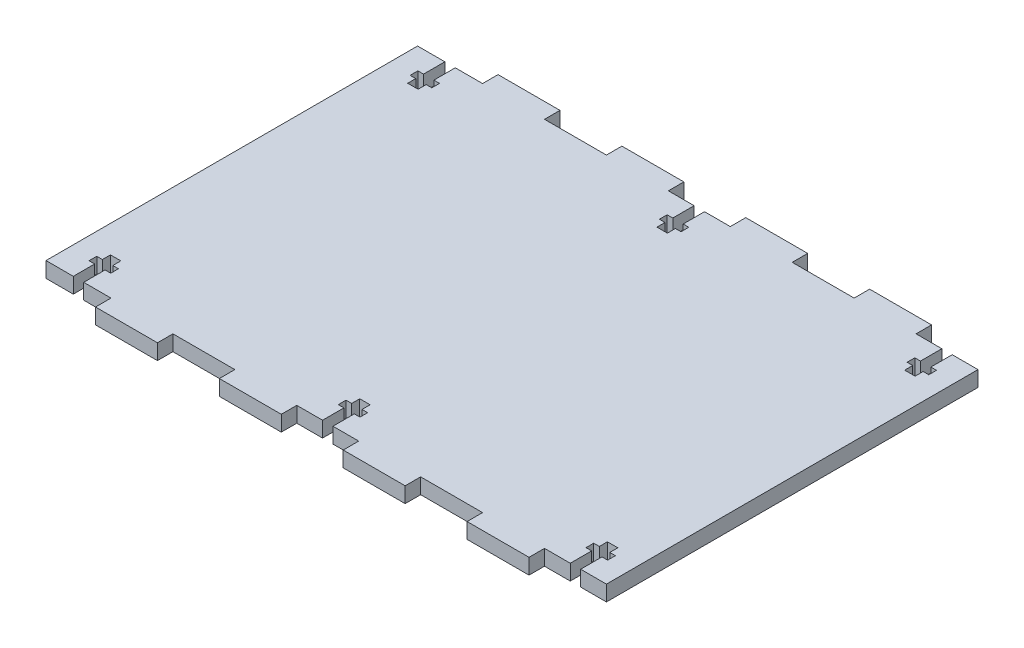
from build123d import *

# Parameters (mm, degrees)
SKETCH1_W           = 229.859874896
SKETCH1_H           = 6.35
BOSS_EXTRUDE1_DEPTH = 152.4
SKETCH2_W           = 25.4
SKETCH2_H           = 6.35
BOSS_EXTRUDE2_DEPTH = 6.35
LPATTERN1_COUNT     = 4
LPATTERN1_PITCH     = 50.8
SKETCH3_W           = 25.4
SKETCH3_H           = 6.35
BOSS_EXTRUDE3_DEPTH = 6.35
LPATTERN2_COUNT     = 4
LPATTERN2_PITCH     = 50.8
CUT_EXTRUDE1_DEPTH  = 6.35


with BuildPart() as part:
    # Sketch1 → Boss-Extrude1 (new body)
    with BuildSketch(Plane.XY):
        with Locations((-24.419947229, 152.4)):
            Rectangle(SKETCH1_W, SKETCH1_H)
    extrude(amount=BOSS_EXTRUDE1_DEPTH)

    # Sketch2 → Boss-Extrude2 (add)
    with BuildSketch(Plane(origin=(0, 155.575, 0), x_dir=(1, 0, 0), z_dir=(0, 1, 0))):
        with Locations((52.409990219, 3.175)):
            Rectangle(SKETCH2_W, SKETCH2_H)
    boss_extrude2 = extrude(amount=-BOSS_EXTRUDE2_DEPTH)

    # LPattern1: Boss-Extrude2 ×4
    with Locations(*[(-i * LPATTERN1_PITCH, 0, 0) for i in range(1, LPATTERN1_COUNT)]):
        add(boss_extrude2)

    # Sketch3 → Boss-Extrude3 (add)
    with BuildSketch(Plane.XY.offset(152.4)):
        with Locations((52.409990219, 152.4)):
            Rectangle(SKETCH3_W, SKETCH3_H)
    boss_extrude3 = extrude(amount=BOSS_EXTRUDE3_DEPTH)

    # LPattern2: Boss-Extrude3 ×4
    with Locations(*[(-i * LPATTERN2_PITCH, 0, 0) for i in range(1, LPATTERN2_COUNT)]):
        add(boss_extrude3)

    # Sketch4 → Cut-Extrude1 (cut)
    with BuildSketch(Plane(origin=(0, 155.575, 0), x_dir=(1, 0, 0), z_dir=(0, 1, 0))):
        Polygon((-123.886347229, 0), (-128.153547229, 0), (-128.153547229, -8.763), (-130.464947229, -8.763), (-130.464947229, -11.938), (-128.153547229, -11.938), (-128.153547229, -15.24), (-123.886347229, -15.24), (-123.886347229, -11.938), (-121.574947229, -11.938), (-121.574947229, -8.763), (-123.886347229, -8.763), align=None)
        Polygon((-21.656409781, 0), (-25.923609781, 0), (-25.923609781, -8.763), (-28.235009781, -8.763), (-28.235009781, -11.938), (-25.923609781, -11.938), (-25.923609781, -15.24), (-21.656409781, -15.24), (-21.656409781, -11.938), (-19.345009781, -11.938), (-19.345009781, -8.763), (-21.656409781, -8.763), align=None)
        Polygon((79.943590219, 0), (75.676390219, 0), (75.676390219, -8.763), (73.364990219, -8.763), (73.364990219, -11.938), (75.676390219, -11.938), (75.676390219, -15.24), (79.943590219, -15.24), (79.943590219, -11.938), (82.254990219, -11.938), (82.254990219, -8.763), (79.943590219, -8.763), align=None)
        Polygon((-128.153547229, -152.4), (-123.886347229, -152.4), (-123.886347229, -143.637), (-121.574947229, -143.637), (-121.574947229, -140.462), (-123.886347229, -140.462), (-123.886347229, -137.16), (-128.153547229, -137.16), (-128.153547229, -140.462), (-130.464947229, -140.462), (-130.464947229, -143.637), (-128.153547229, -143.637), align=None)
        Polygon((-25.923609781, -152.4), (-21.656409781, -152.4), (-21.656409781, -143.637), (-19.345009781, -143.637), (-19.345009781, -140.462), (-21.656409781, -140.462), (-21.656409781, -137.16), (-25.923609781, -137.16), (-25.923609781, -140.462), (-28.235009781, -140.462), (-28.235009781, -143.637), (-25.923609781, -143.637), align=None)
        Polygon((75.676390219, -152.4), (79.943590219, -152.4), (79.943590219, -143.637), (82.254990219, -143.637), (82.254990219, -140.462), (79.943590219, -140.462), (79.943590219, -137.16), (75.676390219, -137.16), (75.676390219, -140.462), (73.364990219, -140.462), (73.364990219, -143.637), (75.676390219, -143.637), align=None)
    extrude(amount=-CUT_EXTRUDE1_DEPTH, mode=Mode.SUBTRACT)


solid = part.part
